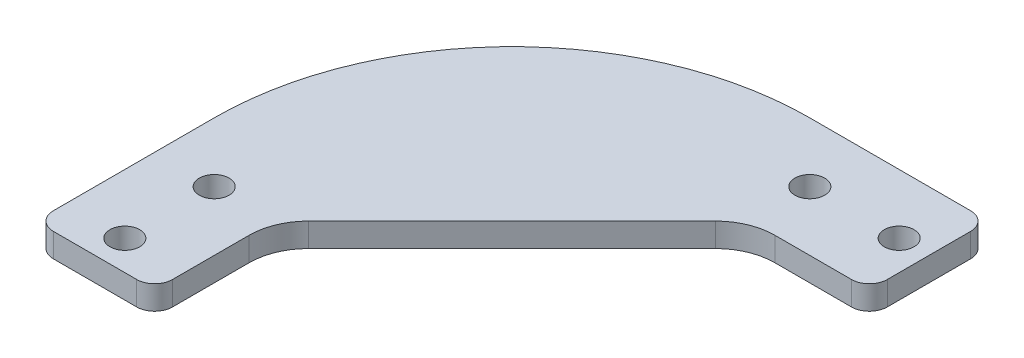
from build123d import *

# Parameters (mm, degrees)
SKETCH1_R           = 2.5
BOSS_EXTRUDE1_DEPTH = 4


with BuildPart() as part:
    # Sketch1 → Boss-Extrude1 (new body)
    with BuildSketch(Plane(origin=(0, 0, 0), x_dir=(1, 0, 0), z_dir=(0, 1, 0))):
        with BuildLine():
            Line((-50, 0), (-50, -27))
            ThreePointArc((-50, -27), (-49.121320344, -29.121320344), (-47, -30))
            Line((-47, -30), (-33, -30))
            ThreePointArc((-33, -30), (-30.878679656, -29.121320344), (-30, -27))
            Line((-30, -27), (-30, -14.142135624))
            ThreePointArc((-30, -14.142135624), (-29.238795325, -10.3153013), (-27.071067812, -7.071067812))
            Line((-27.071067812, -7.071067812), (7.071067812, 27.071067812))
            ThreePointArc((7.071067812, 27.071067812), (10.3153013, 29.238795325), (14.142135624, 30))
            Line((14.142135624, 30), (27, 30))
            ThreePointArc((27, 30), (29.121320344, 30.878679656), (30, 33))
            Line((30, 33), (30, 47))
            ThreePointArc((30, 47), (29.121320344, 49.121320344), (27, 50))
            Line((27, 50), (0, 50))
            ThreePointArc((0, 50), (-35.355339059, 35.355339059), (-50, 0))
        make_face()
        with Locations((-40, -10)):
            Circle(SKETCH1_R, mode=Mode.SUBTRACT)
        with Locations((-40, -25)):
            Circle(SKETCH1_R, mode=Mode.SUBTRACT)
        with Locations((10, 40)):
            Circle(SKETCH1_R, mode=Mode.SUBTRACT)
        with Locations((25, 40)):
            Circle(SKETCH1_R, mode=Mode.SUBTRACT)
    extrude(amount=BOSS_EXTRUDE1_DEPTH)


solid = part.part
